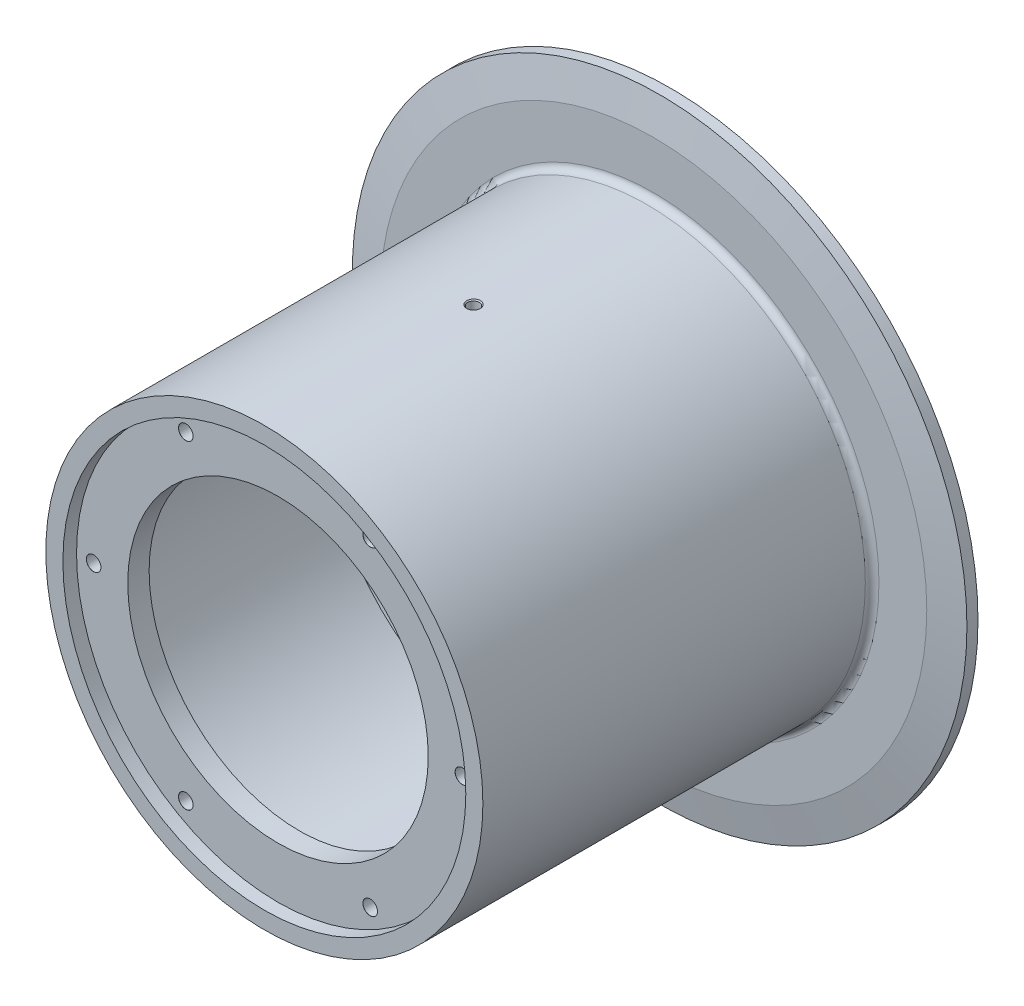
from build123d import *

# Parameters (mm, degrees)
SKETCH_1_R                    = 180
EXTRUDE_1_DEPTH               = 10
SKETCH_2_R                    = 128
EXTRUDE_2_DEPTH               = 238
SKETCH_3_R                    = 120
CUT_EXTRUDE_1_DEPTH           = 86
SKETCH_4_R                    = 118
CUT_EXTRUDE_2_DEPTH           = 131.5
SKETCH_5_R                    = 88
CUT_EXTRUDE_3_DEPTH           = 335.822714283
CUT_EXTRUDE_START             = -8
SKETCH_6_R                    = 118
CUT_EXTRUDE_4_DEPTH           = 8
HOLE_WIZARD_M10_1_D           = 8.5
HOLE_WIZARD_M10_1_CSINK_D     = 8.55
HOLE_WIZARD_M10_1_CSINK_ANGLE = 90
FILLET_1_R                    = 4
CHAMFER_1_SIZE                = 20
CHAMFER_1_SIZE2               = 3.526539614


# Read off the part's stored shape, not the designer's step: M8 螺纹孔1
with BuildPart() as part:
    # 草图1 → 凸台-拉伸1 (new body)
    with BuildSketch(Plane.XY):
        Circle(SKETCH_1_R)
    extrude(amount=EXTRUDE_1_DEPTH)

    # 草图2 → 凸台-拉伸2 (add)
    with BuildSketch(Plane.XY):
        Circle(SKETCH_2_R)
    extrude(amount=EXTRUDE_2_DEPTH)

    # 草图3 → 切除-拉伸1 (cut)
    with BuildSketch(Plane(origin=(0, 0, 0), x_dir=(-1, 0, 0), z_dir=(0, 0, -1))):
        Circle(SKETCH_3_R)
    extrude(amount=-CUT_EXTRUDE_1_DEPTH, mode=Mode.SUBTRACT)

    # 草图4 → 切除-拉伸2 (cut)
    with BuildSketch(Plane(origin=(0, 0, 86), x_dir=(-1, 0, 0), z_dir=(0, 0, -1))):
        Circle(SKETCH_4_R)
    extrude(amount=-CUT_EXTRUDE_2_DEPTH, mode=Mode.SUBTRACT)

    # 草图5 → 切除-拉伸3 (cut, through all)
    with BuildSketch(Plane(origin=(0, 0, 217.5), x_dir=(-1, 0, 0), z_dir=(0, 0, -1))):
        Circle(SKETCH_5_R)
    extrude(amount=-CUT_EXTRUDE_3_DEPTH, mode=Mode.SUBTRACT)

    # 草图6 → 切除-拉伸4 (cut)
    with BuildSketch(Plane.XY.offset(238).offset(CUT_EXTRUDE_START)):
        with Locations(Location((0, 0, 0), (0, 0, 180))):
            Circle(SKETCH_6_R)
    extrude(amount=CUT_EXTRUDE_4_DEPTH, mode=Mode.SUBTRACT)

    # M10 螺纹孔的螺纹孔钻头1 (through all)
    with Locations(Plane.XY.offset(230)):
        with Locations((108, 0), (54, -93.530743609), (-54, -93.530743609), (-108, 0), (-54, 93.530743609), (54, 93.530743609)):
            CounterSinkHole(HOLE_WIZARD_M10_1_D / 2, HOLE_WIZARD_M10_1_CSINK_D / 2, counter_sink_angle=HOLE_WIZARD_M10_1_CSINK_ANGLE)

    # 圆角1
    fillet_1_edges = [part.edges().sort_by_distance(p)[0] for p in [
        (-128, 0, 10),
    ]]
    fillet(fillet_1_edges, radius=FILLET_1_R)

    # 倒角1
    chamfer_1_edges = [part.edges().sort_by_distance(p)[0] for p in [
        (-180, 0, 10),
    ]]
    chamfer_1_side = [part.faces().sort_by_distance(p)[0] for p in [
        (-137.091168825, 0, 10),
    ]]
    chamfer(chamfer_1_edges, length=CHAMFER_1_SIZE, length2=CHAMFER_1_SIZE2, reference=chamfer_1_side[0])

    # M8 螺纹孔1 outline → M8 螺纹孔1 (revolve, cut)
    with BuildSketch(Plane.XY.offset(115.5)):
        Polygon((4.025021706, 128.000021706), (0, 128.000021706), (0, 117.951000003), (3.4, 117.951000003), (3.4, 127.375), align=None)
    revolve(axis=Axis((0, 0, 115.5), (0, 1, 0)), mode=Mode.SUBTRACT)


solid = part.part
